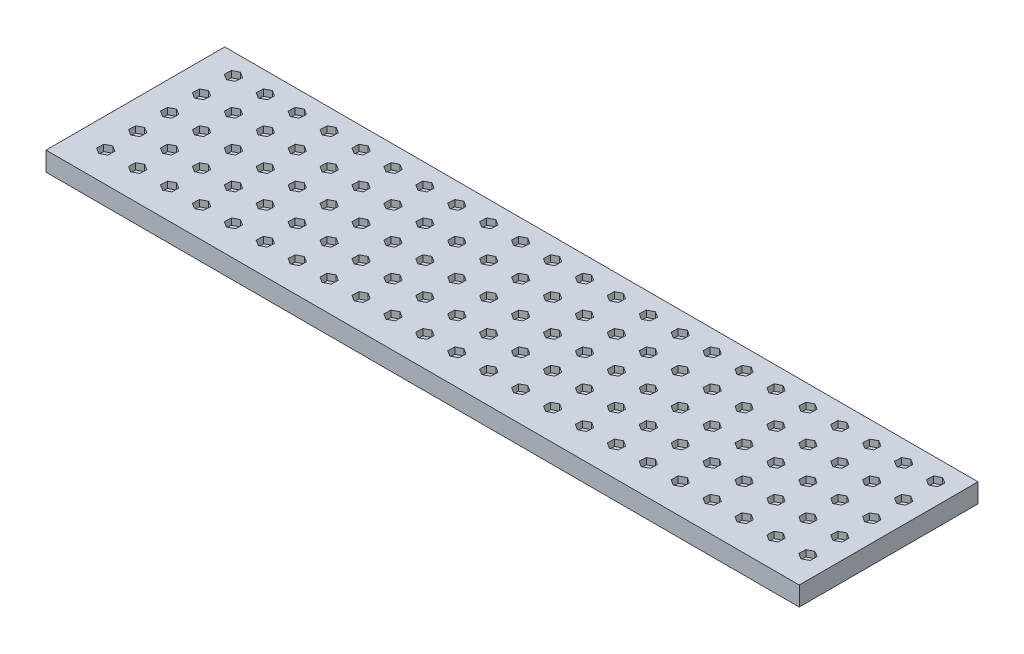
from build123d import *

# Parameters (mm, degrees)
SKETCH1_W           = 236
SKETCH1_H           = 56
BOSS_EXTRUDE1_DEPTH = 6
CUT_EXTRUDE1_DEPTH  = 2
CUT_EXTRUDE2_DEPTH  = 2


with BuildPart() as part:
    # Sketch1 → Boss-Extrude1 (new body)
    with BuildSketch(Plane(origin=(0, 0, 0), x_dir=(1, 0, 0), z_dir=(0, 1, 0))):
        Rectangle(SKETCH1_W, SKETCH1_H)
    extrude(amount=BOSS_EXTRUDE1_DEPTH)

    # Sketch2 → Cut-Extrude1 (cut)
    with BuildSketch(Plane(origin=(0, 6, 0), x_dir=(1, 0, 0), z_dir=(0, 1, 0))):
        Polygon((-96.969664565, 20.342464515), (-96.878055923, 22.465137638), (-98.670540451, 23.605809611), (-100.554633621, 22.62380846), (-100.646242263, 20.501135336), (-98.853757734, 19.360463364), align=None)
        Polygon((-106.969664565, 20.342464515), (-106.878055923, 22.465137638), (-108.670540451, 23.605809611), (-110.554633621, 22.62380846), (-110.646242263, 20.501135336), (-108.853757734, 19.360463364), align=None)
        Polygon((-86.969664565, 20.342464515), (-86.878055923, 22.465137638), (-88.670540451, 23.605809611), (-90.554633621, 22.62380846), (-90.646242263, 20.501135336), (-88.853757734, 19.360463364), align=None)
        Polygon((-76.969664565, 20.342464515), (-76.878055923, 22.465137638), (-78.670540451, 23.605809611), (-80.554633621, 22.62380846), (-80.646242263, 20.501135336), (-78.853757734, 19.360463364), align=None)
        Polygon((-66.969664565, 20.342464515), (-66.878055923, 22.465137638), (-68.670540451, 23.605809611), (-70.554633621, 22.62380846), (-70.646242263, 20.501135336), (-68.853757734, 19.360463364), align=None)
        Polygon((-56.969664565, 20.342464515), (-56.878055923, 22.465137638), (-58.670540451, 23.605809611), (-60.554633621, 22.62380846), (-60.646242263, 20.501135336), (-58.853757734, 19.360463364), align=None)
        Polygon((-46.969664565, 20.342464515), (-46.878055923, 22.465137638), (-48.670540451, 23.605809611), (-50.554633621, 22.62380846), (-50.646242263, 20.501135336), (-48.853757734, 19.360463364), align=None)
        Polygon((-36.969664565, 20.342464515), (-36.878055923, 22.465137638), (-38.670540451, 23.605809611), (-40.554633621, 22.62380846), (-40.646242263, 20.501135336), (-38.853757734, 19.360463364), align=None)
        Polygon((-26.969664565, 20.342464515), (-26.878055923, 22.465137638), (-28.670540451, 23.605809611), (-30.554633621, 22.62380846), (-30.646242263, 20.501135336), (-28.853757734, 19.360463364), align=None)
        Polygon((-16.969664565, 20.342464515), (-16.878055923, 22.465137638), (-18.670540451, 23.605809611), (-20.554633621, 22.62380846), (-20.646242263, 20.501135336), (-18.853757734, 19.360463364), align=None)
        Polygon((-6.969664565, 20.342464515), (-6.878055923, 22.465137638), (-8.670540451, 23.605809611), (-10.554633621, 22.62380846), (-10.646242263, 20.501135336), (-8.853757734, 19.360463364), align=None)
        Polygon((3.030335435, 20.342464515), (3.121944077, 22.465137638), (1.329459549, 23.605809611), (-0.554633621, 22.62380846), (-0.646242263, 20.501135336), (1.146242266, 19.360463364), align=None)
        Polygon((13.030335435, 20.342464515), (13.121944077, 22.465137638), (11.329459549, 23.605809611), (9.445366379, 22.62380846), (9.353757737, 20.501135336), (11.146242266, 19.360463364), align=None)
        Polygon((23.030335435, 20.342464515), (23.121944077, 22.465137638), (21.329459549, 23.605809611), (19.445366379, 22.62380846), (19.353757737, 20.501135336), (21.146242266, 19.360463364), align=None)
        Polygon((33.030335435, 20.342464515), (33.121944077, 22.465137638), (31.329459549, 23.605809611), (29.445366379, 22.62380846), (29.353757737, 20.501135336), (31.146242266, 19.360463364), align=None)
        Polygon((43.030335435, 20.342464515), (43.121944077, 22.465137638), (41.329459549, 23.605809611), (39.445366379, 22.62380846), (39.353757737, 20.501135336), (41.146242266, 19.360463364), align=None)
        Polygon((53.030335435, 20.342464515), (53.121944077, 22.465137638), (51.329459549, 23.605809611), (49.445366379, 22.62380846), (49.353757737, 20.501135336), (51.146242266, 19.360463364), align=None)
        Polygon((63.030335435, 20.342464515), (63.121944077, 22.465137638), (61.329459549, 23.605809611), (59.445366379, 22.62380846), (59.353757737, 20.501135336), (61.146242266, 19.360463364), align=None)
        Polygon((73.030335435, 20.342464515), (73.121944077, 22.465137638), (71.329459549, 23.605809611), (69.445366379, 22.62380846), (69.353757737, 20.501135336), (71.146242266, 19.360463364), align=None)
        Polygon((83.030335435, 20.342464515), (83.121944077, 22.465137638), (81.329459549, 23.605809611), (79.445366379, 22.62380846), (79.353757737, 20.501135336), (81.146242266, 19.360463364), align=None)
        Polygon((93.030335435, 20.342464515), (93.121944077, 22.465137638), (91.329459549, 23.605809611), (89.445366379, 22.62380846), (89.353757737, 20.501135336), (91.146242266, 19.360463364), align=None)
        Polygon((103.030335435, 20.342464515), (103.121944077, 22.465137638), (101.329459549, 23.605809611), (99.445366379, 22.62380846), (99.353757737, 20.501135336), (101.146242266, 19.360463364), align=None)
        Polygon((113.030335435, 20.342464515), (113.121944077, 22.465137638), (111.329459549, 23.605809611), (109.445366379, 22.62380846), (109.353757737, 20.501135336), (111.146242266, 19.360463364), align=None)
        Polygon((-96.969664565, 10.342464515), (-96.878055923, 12.465137638), (-98.670540451, 13.605809611), (-100.554633621, 12.62380846), (-100.646242263, 10.501135336), (-98.853757734, 9.360463364), align=None)
        Polygon((-86.969664565, 10.342464515), (-86.878055923, 12.465137638), (-88.670540451, 13.605809611), (-90.554633621, 12.62380846), (-90.646242263, 10.501135336), (-88.853757734, 9.360463364), align=None)
        Polygon((-76.969664565, 10.342464515), (-76.878055923, 12.465137638), (-78.670540451, 13.605809611), (-80.554633621, 12.62380846), (-80.646242263, 10.501135336), (-78.853757734, 9.360463364), align=None)
        Polygon((-66.969664565, 10.342464515), (-66.878055923, 12.465137638), (-68.670540451, 13.605809611), (-70.554633621, 12.62380846), (-70.646242263, 10.501135336), (-68.853757734, 9.360463364), align=None)
        Polygon((-56.969664565, 10.342464515), (-56.878055923, 12.465137638), (-58.670540451, 13.605809611), (-60.554633621, 12.62380846), (-60.646242263, 10.501135336), (-58.853757734, 9.360463364), align=None)
        Polygon((-46.969664565, 10.342464515), (-46.878055923, 12.465137638), (-48.670540451, 13.605809611), (-50.554633621, 12.62380846), (-50.646242263, 10.501135336), (-48.853757734, 9.360463364), align=None)
        Polygon((-36.969664565, 10.342464515), (-36.878055923, 12.465137638), (-38.670540451, 13.605809611), (-40.554633621, 12.62380846), (-40.646242263, 10.501135336), (-38.853757734, 9.360463364), align=None)
        Polygon((-26.969664565, 10.342464515), (-26.878055923, 12.465137638), (-28.670540451, 13.605809611), (-30.554633621, 12.62380846), (-30.646242263, 10.501135336), (-28.853757734, 9.360463364), align=None)
        Polygon((-16.969664565, 10.342464515), (-16.878055923, 12.465137638), (-18.670540451, 13.605809611), (-20.554633621, 12.62380846), (-20.646242263, 10.501135336), (-18.853757734, 9.360463364), align=None)
        Polygon((-6.969664565, 10.342464515), (-6.878055923, 12.465137638), (-8.670540451, 13.605809611), (-10.554633621, 12.62380846), (-10.646242263, 10.501135336), (-8.853757734, 9.360463364), align=None)
        Polygon((3.030335435, 10.342464515), (3.121944077, 12.465137638), (1.329459549, 13.605809611), (-0.554633621, 12.62380846), (-0.646242263, 10.501135336), (1.146242266, 9.360463364), align=None)
        Polygon((13.030335435, 10.342464515), (13.121944077, 12.465137638), (11.329459549, 13.605809611), (9.445366379, 12.62380846), (9.353757737, 10.501135336), (11.146242266, 9.360463364), align=None)
        Polygon((23.030335435, 10.342464515), (23.121944077, 12.465137638), (21.329459549, 13.605809611), (19.445366379, 12.62380846), (19.353757737, 10.501135336), (21.146242266, 9.360463364), align=None)
        Polygon((33.030335435, 10.342464515), (33.121944077, 12.465137638), (31.329459549, 13.605809611), (29.445366379, 12.62380846), (29.353757737, 10.501135336), (31.146242266, 9.360463364), align=None)
        Polygon((43.030335435, 10.342464515), (43.121944077, 12.465137638), (41.329459549, 13.605809611), (39.445366379, 12.62380846), (39.353757737, 10.501135336), (41.146242266, 9.360463364), align=None)
        Polygon((53.030335435, 10.342464515), (53.121944077, 12.465137638), (51.329459549, 13.605809611), (49.445366379, 12.62380846), (49.353757737, 10.501135336), (51.146242266, 9.360463364), align=None)
        Polygon((63.030335435, 10.342464515), (63.121944077, 12.465137638), (61.329459549, 13.605809611), (59.445366379, 12.62380846), (59.353757737, 10.501135336), (61.146242266, 9.360463364), align=None)
        Polygon((73.030335435, 10.342464515), (73.121944077, 12.465137638), (71.329459549, 13.605809611), (69.445366379, 12.62380846), (69.353757737, 10.501135336), (71.146242266, 9.360463364), align=None)
        Polygon((83.030335435, 10.342464515), (83.121944077, 12.465137638), (81.329459549, 13.605809611), (79.445366379, 12.62380846), (79.353757737, 10.501135336), (81.146242266, 9.360463364), align=None)
        Polygon((93.030335435, 10.342464515), (93.121944077, 12.465137638), (91.329459549, 13.605809611), (89.445366379, 12.62380846), (89.353757737, 10.501135336), (91.146242266, 9.360463364), align=None)
        Polygon((103.030335435, 10.342464515), (103.121944077, 12.465137638), (101.329459549, 13.605809611), (99.445366379, 12.62380846), (99.353757737, 10.501135336), (101.146242266, 9.360463364), align=None)
        Polygon((113.030335435, 10.342464515), (113.121944077, 12.465137638), (111.329459549, 13.605809611), (109.445366379, 12.62380846), (109.353757737, 10.501135336), (111.146242266, 9.360463364), align=None)
        Polygon((-96.969664565, 0.342464515), (-96.878055923, 2.465137638), (-98.670540451, 3.605809611), (-100.554633621, 2.62380846), (-100.646242263, 0.501135336), (-98.853757734, -0.639536636), align=None)
        Polygon((-86.969664565, 0.342464515), (-86.878055923, 2.465137638), (-88.670540451, 3.605809611), (-90.554633621, 2.62380846), (-90.646242263, 0.501135336), (-88.853757734, -0.639536636), align=None)
        Polygon((-76.969664565, 0.342464515), (-76.878055923, 2.465137638), (-78.670540451, 3.605809611), (-80.554633621, 2.62380846), (-80.646242263, 0.501135336), (-78.853757734, -0.639536636), align=None)
        Polygon((-66.969664565, 0.342464515), (-66.878055923, 2.465137638), (-68.670540451, 3.605809611), (-70.554633621, 2.62380846), (-70.646242263, 0.501135336), (-68.853757734, -0.639536636), align=None)
        Polygon((-56.969664565, 0.342464515), (-56.878055923, 2.465137638), (-58.670540451, 3.605809611), (-60.554633621, 2.62380846), (-60.646242263, 0.501135336), (-58.853757734, -0.639536636), align=None)
        Polygon((-46.969664565, 0.342464515), (-46.878055923, 2.465137638), (-48.670540451, 3.605809611), (-50.554633621, 2.62380846), (-50.646242263, 0.501135336), (-48.853757734, -0.639536636), align=None)
        Polygon((-36.969664565, 0.342464515), (-36.878055923, 2.465137638), (-38.670540451, 3.605809611), (-40.554633621, 2.62380846), (-40.646242263, 0.501135336), (-38.853757734, -0.639536636), align=None)
        Polygon((-26.969664565, 0.342464515), (-26.878055923, 2.465137638), (-28.670540451, 3.605809611), (-30.554633621, 2.62380846), (-30.646242263, 0.501135336), (-28.853757734, -0.639536636), align=None)
        Polygon((-16.969664565, 0.342464515), (-16.878055923, 2.465137638), (-18.670540451, 3.605809611), (-20.554633621, 2.62380846), (-20.646242263, 0.501135336), (-18.853757734, -0.639536636), align=None)
        Polygon((-6.969664565, 0.342464515), (-6.878055923, 2.465137638), (-8.670540451, 3.605809611), (-10.554633621, 2.62380846), (-10.646242263, 0.501135336), (-8.853757734, -0.639536636), align=None)
        Polygon((3.030335435, 0.342464515), (3.121944077, 2.465137638), (1.329459549, 3.605809611), (-0.554633621, 2.62380846), (-0.646242263, 0.501135336), (1.146242266, -0.639536636), align=None)
        Polygon((13.030335435, 0.342464515), (13.121944077, 2.465137638), (11.329459549, 3.605809611), (9.445366379, 2.62380846), (9.353757737, 0.501135336), (11.146242266, -0.639536636), align=None)
        Polygon((23.030335435, 0.342464515), (23.121944077, 2.465137638), (21.329459549, 3.605809611), (19.445366379, 2.62380846), (19.353757737, 0.501135336), (21.146242266, -0.639536636), align=None)
        Polygon((33.030335435, 0.342464515), (33.121944077, 2.465137638), (31.329459549, 3.605809611), (29.445366379, 2.62380846), (29.353757737, 0.501135336), (31.146242266, -0.639536636), align=None)
        Polygon((43.030335435, 0.342464515), (43.121944077, 2.465137638), (41.329459549, 3.605809611), (39.445366379, 2.62380846), (39.353757737, 0.501135336), (41.146242266, -0.639536636), align=None)
        Polygon((53.030335435, 0.342464515), (53.121944077, 2.465137638), (51.329459549, 3.605809611), (49.445366379, 2.62380846), (49.353757737, 0.501135336), (51.146242266, -0.639536636), align=None)
        Polygon((63.030335435, 0.342464515), (63.121944077, 2.465137638), (61.329459549, 3.605809611), (59.445366379, 2.62380846), (59.353757737, 0.501135336), (61.146242266, -0.639536636), align=None)
        Polygon((73.030335435, 0.342464515), (73.121944077, 2.465137638), (71.329459549, 3.605809611), (69.445366379, 2.62380846), (69.353757737, 0.501135336), (71.146242266, -0.639536636), align=None)
        Polygon((83.030335435, 0.342464515), (83.121944077, 2.465137638), (81.329459549, 3.605809611), (79.445366379, 2.62380846), (79.353757737, 0.501135336), (81.146242266, -0.639536636), align=None)
        Polygon((93.030335435, 0.342464515), (93.121944077, 2.465137638), (91.329459549, 3.605809611), (89.445366379, 2.62380846), (89.353757737, 0.501135336), (91.146242266, -0.639536636), align=None)
        Polygon((103.030335435, 0.342464515), (103.121944077, 2.465137638), (101.329459549, 3.605809611), (99.445366379, 2.62380846), (99.353757737, 0.501135336), (101.146242266, -0.639536636), align=None)
        Polygon((113.030335435, 0.342464515), (113.121944077, 2.465137638), (111.329459549, 3.605809611), (109.445366379, 2.62380846), (109.353757737, 0.501135336), (111.146242266, -0.639536636), align=None)
        Polygon((-96.969664565, -9.657535485), (-96.878055923, -7.534862362), (-98.670540451, -6.394190389), (-100.554633621, -7.37619154), (-100.646242263, -9.498864664), (-98.853757734, -10.639536636), align=None)
        Polygon((-86.969664565, -9.657535485), (-86.878055923, -7.534862362), (-88.670540451, -6.394190389), (-90.554633621, -7.37619154), (-90.646242263, -9.498864664), (-88.853757734, -10.639536636), align=None)
        Polygon((-76.969664565, -9.657535485), (-76.878055923, -7.534862362), (-78.670540451, -6.394190389), (-80.554633621, -7.37619154), (-80.646242263, -9.498864664), (-78.853757734, -10.639536636), align=None)
        Polygon((-66.969664565, -9.657535485), (-66.878055923, -7.534862362), (-68.670540451, -6.394190389), (-70.554633621, -7.37619154), (-70.646242263, -9.498864664), (-68.853757734, -10.639536636), align=None)
        Polygon((-56.969664565, -9.657535485), (-56.878055923, -7.534862362), (-58.670540451, -6.394190389), (-60.554633621, -7.37619154), (-60.646242263, -9.498864664), (-58.853757734, -10.639536636), align=None)
        Polygon((-46.969664565, -9.657535485), (-46.878055923, -7.534862362), (-48.670540451, -6.394190389), (-50.554633621, -7.37619154), (-50.646242263, -9.498864664), (-48.853757734, -10.639536636), align=None)
        Polygon((-36.969664565, -9.657535485), (-36.878055923, -7.534862362), (-38.670540451, -6.394190389), (-40.554633621, -7.37619154), (-40.646242263, -9.498864664), (-38.853757734, -10.639536636), align=None)
        Polygon((-26.969664565, -9.657535485), (-26.878055923, -7.534862362), (-28.670540451, -6.394190389), (-30.554633621, -7.37619154), (-30.646242263, -9.498864664), (-28.853757734, -10.639536636), align=None)
        Polygon((-16.969664565, -9.657535485), (-16.878055923, -7.534862362), (-18.670540451, -6.394190389), (-20.554633621, -7.37619154), (-20.646242263, -9.498864664), (-18.853757734, -10.639536636), align=None)
        Polygon((-6.969664565, -9.657535485), (-6.878055923, -7.534862362), (-8.670540451, -6.394190389), (-10.554633621, -7.37619154), (-10.646242263, -9.498864664), (-8.853757734, -10.639536636), align=None)
        Polygon((3.030335435, -9.657535485), (3.121944077, -7.534862362), (1.329459549, -6.394190389), (-0.554633621, -7.37619154), (-0.646242263, -9.498864664), (1.146242266, -10.639536636), align=None)
        Polygon((13.030335435, -9.657535485), (13.121944077, -7.534862362), (11.329459549, -6.394190389), (9.445366379, -7.37619154), (9.353757737, -9.498864664), (11.146242266, -10.639536636), align=None)
        Polygon((23.030335435, -9.657535485), (23.121944077, -7.534862362), (21.329459549, -6.394190389), (19.445366379, -7.37619154), (19.353757737, -9.498864664), (21.146242266, -10.639536636), align=None)
        Polygon((33.030335435, -9.657535485), (33.121944077, -7.534862362), (31.329459549, -6.394190389), (29.445366379, -7.37619154), (29.353757737, -9.498864664), (31.146242266, -10.639536636), align=None)
        Polygon((43.030335435, -9.657535485), (43.121944077, -7.534862362), (41.329459549, -6.394190389), (39.445366379, -7.37619154), (39.353757737, -9.498864664), (41.146242266, -10.639536636), align=None)
        Polygon((53.030335435, -9.657535485), (53.121944077, -7.534862362), (51.329459549, -6.394190389), (49.445366379, -7.37619154), (49.353757737, -9.498864664), (51.146242266, -10.639536636), align=None)
        Polygon((63.030335435, -9.657535485), (63.121944077, -7.534862362), (61.329459549, -6.394190389), (59.445366379, -7.37619154), (59.353757737, -9.498864664), (61.146242266, -10.639536636), align=None)
        Polygon((73.030335435, -9.657535485), (73.121944077, -7.534862362), (71.329459549, -6.394190389), (69.445366379, -7.37619154), (69.353757737, -9.498864664), (71.146242266, -10.639536636), align=None)
        Polygon((83.030335435, -9.657535485), (83.121944077, -7.534862362), (81.329459549, -6.394190389), (79.445366379, -7.37619154), (79.353757737, -9.498864664), (81.146242266, -10.639536636), align=None)
        Polygon((93.030335435, -9.657535485), (93.121944077, -7.534862362), (91.329459549, -6.394190389), (89.445366379, -7.37619154), (89.353757737, -9.498864664), (91.146242266, -10.639536636), align=None)
        Polygon((103.030335435, -9.657535485), (103.121944077, -7.534862362), (101.329459549, -6.394190389), (99.445366379, -7.37619154), (99.353757737, -9.498864664), (101.146242266, -10.639536636), align=None)
        Polygon((113.030335435, -9.657535485), (113.121944077, -7.534862362), (111.329459549, -6.394190389), (109.445366379, -7.37619154), (109.353757737, -9.498864664), (111.146242266, -10.639536636), align=None)
        Polygon((-96.969664565, -19.657535485), (-96.878055923, -17.534862362), (-98.670540451, -16.394190389), (-100.554633621, -17.37619154), (-100.646242263, -19.498864664), (-98.853757734, -20.639536636), align=None)
        Polygon((-86.969664565, -19.657535485), (-86.878055923, -17.534862362), (-88.670540451, -16.394190389), (-90.554633621, -17.37619154), (-90.646242263, -19.498864664), (-88.853757734, -20.639536636), align=None)
        Polygon((-76.969664565, -19.657535485), (-76.878055923, -17.534862362), (-78.670540451, -16.394190389), (-80.554633621, -17.37619154), (-80.646242263, -19.498864664), (-78.853757734, -20.639536636), align=None)
        Polygon((-66.969664565, -19.657535485), (-66.878055923, -17.534862362), (-68.670540451, -16.394190389), (-70.554633621, -17.37619154), (-70.646242263, -19.498864664), (-68.853757734, -20.639536636), align=None)
        Polygon((-56.969664565, -19.657535485), (-56.878055923, -17.534862362), (-58.670540451, -16.394190389), (-60.554633621, -17.37619154), (-60.646242263, -19.498864664), (-58.853757734, -20.639536636), align=None)
        Polygon((-46.969664565, -19.657535485), (-46.878055923, -17.534862362), (-48.670540451, -16.394190389), (-50.554633621, -17.37619154), (-50.646242263, -19.498864664), (-48.853757734, -20.639536636), align=None)
        Polygon((-36.969664565, -19.657535485), (-36.878055923, -17.534862362), (-38.670540451, -16.394190389), (-40.554633621, -17.37619154), (-40.646242263, -19.498864664), (-38.853757734, -20.639536636), align=None)
        Polygon((-26.969664565, -19.657535485), (-26.878055923, -17.534862362), (-28.670540451, -16.394190389), (-30.554633621, -17.37619154), (-30.646242263, -19.498864664), (-28.853757734, -20.639536636), align=None)
        Polygon((-16.969664565, -19.657535485), (-16.878055923, -17.534862362), (-18.670540451, -16.394190389), (-20.554633621, -17.37619154), (-20.646242263, -19.498864664), (-18.853757734, -20.639536636), align=None)
        Polygon((-6.969664565, -19.657535485), (-6.878055923, -17.534862362), (-8.670540451, -16.394190389), (-10.554633621, -17.37619154), (-10.646242263, -19.498864664), (-8.853757734, -20.639536636), align=None)
        Polygon((3.030335435, -19.657535485), (3.121944077, -17.534862362), (1.329459549, -16.394190389), (-0.554633621, -17.37619154), (-0.646242263, -19.498864664), (1.146242266, -20.639536636), align=None)
        Polygon((13.030335435, -19.657535485), (13.121944077, -17.534862362), (11.329459549, -16.394190389), (9.445366379, -17.37619154), (9.353757737, -19.498864664), (11.146242266, -20.639536636), align=None)
        Polygon((23.030335435, -19.657535485), (23.121944077, -17.534862362), (21.329459549, -16.394190389), (19.445366379, -17.37619154), (19.353757737, -19.498864664), (21.146242266, -20.639536636), align=None)
        Polygon((33.030335435, -19.657535485), (33.121944077, -17.534862362), (31.329459549, -16.394190389), (29.445366379, -17.37619154), (29.353757737, -19.498864664), (31.146242266, -20.639536636), align=None)
        Polygon((43.030335435, -19.657535485), (43.121944077, -17.534862362), (41.329459549, -16.394190389), (39.445366379, -17.37619154), (39.353757737, -19.498864664), (41.146242266, -20.639536636), align=None)
        Polygon((53.030335435, -19.657535485), (53.121944077, -17.534862362), (51.329459549, -16.394190389), (49.445366379, -17.37619154), (49.353757737, -19.498864664), (51.146242266, -20.639536636), align=None)
        Polygon((63.030335435, -19.657535485), (63.121944077, -17.534862362), (61.329459549, -16.394190389), (59.445366379, -17.37619154), (59.353757737, -19.498864664), (61.146242266, -20.639536636), align=None)
        Polygon((73.030335435, -19.657535485), (73.121944077, -17.534862362), (71.329459549, -16.394190389), (69.445366379, -17.37619154), (69.353757737, -19.498864664), (71.146242266, -20.639536636), align=None)
        Polygon((83.030335435, -19.657535485), (83.121944077, -17.534862362), (81.329459549, -16.394190389), (79.445366379, -17.37619154), (79.353757737, -19.498864664), (81.146242266, -20.639536636), align=None)
        Polygon((93.030335435, -19.657535485), (93.121944077, -17.534862362), (91.329459549, -16.394190389), (89.445366379, -17.37619154), (89.353757737, -19.498864664), (91.146242266, -20.639536636), align=None)
        Polygon((103.030335435, -19.657535485), (103.121944077, -17.534862362), (101.329459549, -16.394190389), (99.445366379, -17.37619154), (99.353757737, -19.498864664), (101.146242266, -20.639536636), align=None)
        Polygon((113.030335435, -19.657535485), (113.121944077, -17.534862362), (111.329459549, -16.394190389), (109.445366379, -17.37619154), (109.353757737, -19.498864664), (111.146242266, -20.639536636), align=None)
        Polygon((-106.969664565, 10.342464515), (-106.878055923, 12.465137638), (-108.670540451, 13.605809611), (-110.554633621, 12.62380846), (-110.646242263, 10.501135336), (-108.853757734, 9.360463364), align=None)
        Polygon((-106.969664565, 0.342464515), (-106.878055923, 2.465137638), (-108.670540451, 3.605809611), (-110.554633621, 2.62380846), (-110.646242263, 0.501135336), (-108.853757734, -0.639536636), align=None)
        Polygon((-106.969664565, -9.657535485), (-106.878055923, -7.534862362), (-108.670540451, -6.394190389), (-110.554633621, -7.37619154), (-110.646242263, -9.498864664), (-108.853757734, -10.639536636), align=None)
        Polygon((-106.969664565, -19.657535485), (-106.878055923, -17.534862362), (-108.670540451, -16.394190389), (-110.554633621, -17.37619154), (-110.646242263, -19.498864664), (-108.853757734, -20.639536636), align=None)
    extrude(amount=-CUT_EXTRUDE1_DEPTH, mode=Mode.SUBTRACT)

    # Sketch3 → Cut-Extrude2 (cut)
    with BuildSketch(Plane.XZ):
        Polygon((-97.156278287, 20.056363505), (-96.902137883, 22.165758203), (-98.601857076, 23.440547597), (-100.555716672, 22.605942294), (-100.809857076, 20.496547597), (-99.110137883, 19.221758203), align=None)
        Polygon((-107.156278287, 20.056363505), (-106.902137883, 22.165758203), (-108.601857076, 23.440547597), (-110.555716672, 22.605942294), (-110.809857076, 20.496547597), (-109.110137883, 19.221758203), align=None)
        Polygon((-87.156278287, 20.056363505), (-86.902137883, 22.165758203), (-88.601857076, 23.440547597), (-90.555716672, 22.605942294), (-90.809857076, 20.496547597), (-89.110137883, 19.221758203), align=None)
        Polygon((-77.156278287, 20.056363505), (-76.902137883, 22.165758203), (-78.601857076, 23.440547597), (-80.555716672, 22.605942294), (-80.809857076, 20.496547597), (-79.110137883, 19.221758203), align=None)
        Polygon((-67.156278287, 20.056363505), (-66.902137883, 22.165758203), (-68.601857076, 23.440547597), (-70.555716672, 22.605942294), (-70.809857076, 20.496547597), (-69.110137883, 19.221758203), align=None)
        Polygon((-57.156278287, 20.056363505), (-56.902137883, 22.165758203), (-58.601857076, 23.440547597), (-60.555716672, 22.605942294), (-60.809857076, 20.496547597), (-59.110137883, 19.221758203), align=None)
        Polygon((-47.156278287, 20.056363505), (-46.902137883, 22.165758203), (-48.601857076, 23.440547597), (-50.555716672, 22.605942294), (-50.809857076, 20.496547597), (-49.110137883, 19.221758203), align=None)
        Polygon((-37.156278287, 20.056363505), (-36.902137883, 22.165758203), (-38.601857076, 23.440547597), (-40.555716672, 22.605942294), (-40.809857076, 20.496547597), (-39.110137883, 19.221758203), align=None)
        Polygon((-27.156278287, 20.056363505), (-26.902137883, 22.165758203), (-28.601857076, 23.440547597), (-30.555716672, 22.605942294), (-30.809857076, 20.496547597), (-29.110137883, 19.221758203), align=None)
        Polygon((-17.156278287, 20.056363505), (-16.902137883, 22.165758203), (-18.601857076, 23.440547597), (-20.555716672, 22.605942294), (-20.809857076, 20.496547597), (-19.110137883, 19.221758203), align=None)
        Polygon((-7.156278287, 20.056363505), (-6.902137883, 22.165758203), (-8.601857076, 23.440547597), (-10.555716672, 22.605942294), (-10.809857076, 20.496547597), (-9.110137883, 19.221758203), align=None)
        Polygon((2.843721713, 20.056363505), (3.097862117, 22.165758203), (1.398142924, 23.440547597), (-0.555716672, 22.605942294), (-0.809857076, 20.496547597), (0.889862117, 19.221758203), align=None)
        Polygon((12.843721713, 20.056363505), (13.097862117, 22.165758203), (11.398142924, 23.440547597), (9.444283328, 22.605942294), (9.190142924, 20.496547597), (10.889862117, 19.221758203), align=None)
        Polygon((22.843721713, 20.056363505), (23.097862117, 22.165758203), (21.398142924, 23.440547597), (19.444283328, 22.605942294), (19.190142924, 20.496547597), (20.889862117, 19.221758203), align=None)
        Polygon((32.843721713, 20.056363505), (33.097862117, 22.165758203), (31.398142924, 23.440547597), (29.444283328, 22.605942294), (29.190142924, 20.496547597), (30.889862117, 19.221758203), align=None)
        Polygon((42.843721713, 20.056363505), (43.097862117, 22.165758203), (41.398142924, 23.440547597), (39.444283328, 22.605942294), (39.190142924, 20.496547597), (40.889862117, 19.221758203), align=None)
        Polygon((52.843721713, 20.056363505), (53.097862117, 22.165758203), (51.398142924, 23.440547597), (49.444283328, 22.605942294), (49.190142924, 20.496547597), (50.889862117, 19.221758203), align=None)
        Polygon((62.843721713, 20.056363505), (63.097862117, 22.165758203), (61.398142924, 23.440547597), (59.444283328, 22.605942294), (59.190142924, 20.496547597), (60.889862117, 19.221758203), align=None)
        Polygon((72.843721713, 20.056363505), (73.097862117, 22.165758203), (71.398142924, 23.440547597), (69.444283328, 22.605942294), (69.190142924, 20.496547597), (70.889862117, 19.221758203), align=None)
        Polygon((82.843721713, 20.056363505), (83.097862117, 22.165758203), (81.398142924, 23.440547597), (79.444283328, 22.605942294), (79.190142924, 20.496547597), (80.889862117, 19.221758203), align=None)
        Polygon((92.843721713, 20.056363505), (93.097862117, 22.165758203), (91.398142924, 23.440547597), (89.444283328, 22.605942294), (89.190142924, 20.496547597), (90.889862117, 19.221758203), align=None)
        Polygon((102.843721713, 20.056363505), (103.097862117, 22.165758203), (101.398142924, 23.440547597), (99.444283328, 22.605942294), (99.190142924, 20.496547597), (100.889862117, 19.221758203), align=None)
        Polygon((112.843721713, 20.056363505), (113.097862117, 22.165758203), (111.398142924, 23.440547597), (109.444283328, 22.605942294), (109.190142924, 20.496547597), (110.889862117, 19.221758203), align=None)
        Polygon((-97.156278287, 10.056363505), (-96.902137883, 12.165758203), (-98.601857076, 13.440547597), (-100.555716672, 12.605942294), (-100.809857076, 10.496547597), (-99.110137883, 9.221758203), align=None)
        Polygon((-87.156278287, 10.056363505), (-86.902137883, 12.165758203), (-88.601857076, 13.440547597), (-90.555716672, 12.605942294), (-90.809857076, 10.496547597), (-89.110137883, 9.221758203), align=None)
        Polygon((-77.156278287, 10.056363505), (-76.902137883, 12.165758203), (-78.601857076, 13.440547597), (-80.555716672, 12.605942294), (-80.809857076, 10.496547597), (-79.110137883, 9.221758203), align=None)
        Polygon((-67.156278287, 10.056363505), (-66.902137883, 12.165758203), (-68.601857076, 13.440547597), (-70.555716672, 12.605942294), (-70.809857076, 10.496547597), (-69.110137883, 9.221758203), align=None)
        Polygon((-57.156278287, 10.056363505), (-56.902137883, 12.165758203), (-58.601857076, 13.440547597), (-60.555716672, 12.605942294), (-60.809857076, 10.496547597), (-59.110137883, 9.221758203), align=None)
        Polygon((-47.156278287, 10.056363505), (-46.902137883, 12.165758203), (-48.601857076, 13.440547597), (-50.555716672, 12.605942294), (-50.809857076, 10.496547597), (-49.110137883, 9.221758203), align=None)
        Polygon((-37.156278287, 10.056363505), (-36.902137883, 12.165758203), (-38.601857076, 13.440547597), (-40.555716672, 12.605942294), (-40.809857076, 10.496547597), (-39.110137883, 9.221758203), align=None)
        Polygon((-27.156278287, 10.056363505), (-26.902137883, 12.165758203), (-28.601857076, 13.440547597), (-30.555716672, 12.605942294), (-30.809857076, 10.496547597), (-29.110137883, 9.221758203), align=None)
        Polygon((-17.156278287, 10.056363505), (-16.902137883, 12.165758203), (-18.601857076, 13.440547597), (-20.555716672, 12.605942294), (-20.809857076, 10.496547597), (-19.110137883, 9.221758203), align=None)
        Polygon((-7.156278287, 10.056363505), (-6.902137883, 12.165758203), (-8.601857076, 13.440547597), (-10.555716672, 12.605942294), (-10.809857076, 10.496547597), (-9.110137883, 9.221758203), align=None)
        Polygon((2.843721713, 10.056363505), (3.097862117, 12.165758203), (1.398142924, 13.440547597), (-0.555716672, 12.605942294), (-0.809857076, 10.496547597), (0.889862117, 9.221758203), align=None)
        Polygon((12.843721713, 10.056363505), (13.097862117, 12.165758203), (11.398142924, 13.440547597), (9.444283328, 12.605942294), (9.190142924, 10.496547597), (10.889862117, 9.221758203), align=None)
        Polygon((22.843721713, 10.056363505), (23.097862117, 12.165758203), (21.398142924, 13.440547597), (19.444283328, 12.605942294), (19.190142924, 10.496547597), (20.889862117, 9.221758203), align=None)
        Polygon((32.843721713, 10.056363505), (33.097862117, 12.165758203), (31.398142924, 13.440547597), (29.444283328, 12.605942294), (29.190142924, 10.496547597), (30.889862117, 9.221758203), align=None)
        Polygon((42.843721713, 10.056363505), (43.097862117, 12.165758203), (41.398142924, 13.440547597), (39.444283328, 12.605942294), (39.190142924, 10.496547597), (40.889862117, 9.221758203), align=None)
        Polygon((52.843721713, 10.056363505), (53.097862117, 12.165758203), (51.398142924, 13.440547597), (49.444283328, 12.605942294), (49.190142924, 10.496547597), (50.889862117, 9.221758203), align=None)
        Polygon((62.843721713, 10.056363505), (63.097862117, 12.165758203), (61.398142924, 13.440547597), (59.444283328, 12.605942294), (59.190142924, 10.496547597), (60.889862117, 9.221758203), align=None)
        Polygon((72.843721713, 10.056363505), (73.097862117, 12.165758203), (71.398142924, 13.440547597), (69.444283328, 12.605942294), (69.190142924, 10.496547597), (70.889862117, 9.221758203), align=None)
        Polygon((82.843721713, 10.056363505), (83.097862117, 12.165758203), (81.398142924, 13.440547597), (79.444283328, 12.605942294), (79.190142924, 10.496547597), (80.889862117, 9.221758203), align=None)
        Polygon((92.843721713, 10.056363505), (93.097862117, 12.165758203), (91.398142924, 13.440547597), (89.444283328, 12.605942294), (89.190142924, 10.496547597), (90.889862117, 9.221758203), align=None)
        Polygon((102.843721713, 10.056363505), (103.097862117, 12.165758203), (101.398142924, 13.440547597), (99.444283328, 12.605942294), (99.190142924, 10.496547597), (100.889862117, 9.221758203), align=None)
        Polygon((112.843721713, 10.056363505), (113.097862117, 12.165758203), (111.398142924, 13.440547597), (109.444283328, 12.605942294), (109.190142924, 10.496547597), (110.889862117, 9.221758203), align=None)
        Polygon((-97.156278287, 0.056363505), (-96.902137883, 2.165758203), (-98.601857076, 3.440547597), (-100.555716672, 2.605942294), (-100.809857076, 0.496547597), (-99.110137883, -0.778241797), align=None)
        Polygon((-87.156278287, 0.056363505), (-86.902137883, 2.165758203), (-88.601857076, 3.440547597), (-90.555716672, 2.605942294), (-90.809857076, 0.496547597), (-89.110137883, -0.778241797), align=None)
        Polygon((-77.156278287, 0.056363505), (-76.902137883, 2.165758203), (-78.601857076, 3.440547597), (-80.555716672, 2.605942294), (-80.809857076, 0.496547597), (-79.110137883, -0.778241797), align=None)
        Polygon((-67.156278287, 0.056363505), (-66.902137883, 2.165758203), (-68.601857076, 3.440547597), (-70.555716672, 2.605942294), (-70.809857076, 0.496547597), (-69.110137883, -0.778241797), align=None)
        Polygon((-57.156278287, 0.056363505), (-56.902137883, 2.165758203), (-58.601857076, 3.440547597), (-60.555716672, 2.605942294), (-60.809857076, 0.496547597), (-59.110137883, -0.778241797), align=None)
        Polygon((-47.156278287, 0.056363505), (-46.902137883, 2.165758203), (-48.601857076, 3.440547597), (-50.555716672, 2.605942294), (-50.809857076, 0.496547597), (-49.110137883, -0.778241797), align=None)
        Polygon((-37.156278287, 0.056363505), (-36.902137883, 2.165758203), (-38.601857076, 3.440547597), (-40.555716672, 2.605942294), (-40.809857076, 0.496547597), (-39.110137883, -0.778241797), align=None)
        Polygon((-27.156278287, 0.056363505), (-26.902137883, 2.165758203), (-28.601857076, 3.440547597), (-30.555716672, 2.605942294), (-30.809857076, 0.496547597), (-29.110137883, -0.778241797), align=None)
        Polygon((-17.156278287, 0.056363505), (-16.902137883, 2.165758203), (-18.601857076, 3.440547597), (-20.555716672, 2.605942294), (-20.809857076, 0.496547597), (-19.110137883, -0.778241797), align=None)
        Polygon((-7.156278287, 0.056363505), (-6.902137883, 2.165758203), (-8.601857076, 3.440547597), (-10.555716672, 2.605942294), (-10.809857076, 0.496547597), (-9.110137883, -0.778241797), align=None)
        Polygon((2.843721713, 0.056363505), (3.097862117, 2.165758203), (1.398142924, 3.440547597), (-0.555716672, 2.605942294), (-0.809857076, 0.496547597), (0.889862117, -0.778241797), align=None)
        Polygon((12.843721713, 0.056363505), (13.097862117, 2.165758203), (11.398142924, 3.440547597), (9.444283328, 2.605942294), (9.190142924, 0.496547597), (10.889862117, -0.778241797), align=None)
        Polygon((22.843721713, 0.056363505), (23.097862117, 2.165758203), (21.398142924, 3.440547597), (19.444283328, 2.605942294), (19.190142924, 0.496547597), (20.889862117, -0.778241797), align=None)
        Polygon((32.843721713, 0.056363505), (33.097862117, 2.165758203), (31.398142924, 3.440547597), (29.444283328, 2.605942294), (29.190142924, 0.496547597), (30.889862117, -0.778241797), align=None)
        Polygon((42.843721713, 0.056363505), (43.097862117, 2.165758203), (41.398142924, 3.440547597), (39.444283328, 2.605942294), (39.190142924, 0.496547597), (40.889862117, -0.778241797), align=None)
        Polygon((52.843721713, 0.056363505), (53.097862117, 2.165758203), (51.398142924, 3.440547597), (49.444283328, 2.605942294), (49.190142924, 0.496547597), (50.889862117, -0.778241797), align=None)
        Polygon((62.843721713, 0.056363505), (63.097862117, 2.165758203), (61.398142924, 3.440547597), (59.444283328, 2.605942294), (59.190142924, 0.496547597), (60.889862117, -0.778241797), align=None)
        Polygon((72.843721713, 0.056363505), (73.097862117, 2.165758203), (71.398142924, 3.440547597), (69.444283328, 2.605942294), (69.190142924, 0.496547597), (70.889862117, -0.778241797), align=None)
        Polygon((82.843721713, 0.056363505), (83.097862117, 2.165758203), (81.398142924, 3.440547597), (79.444283328, 2.605942294), (79.190142924, 0.496547597), (80.889862117, -0.778241797), align=None)
        Polygon((92.843721713, 0.056363505), (93.097862117, 2.165758203), (91.398142924, 3.440547597), (89.444283328, 2.605942294), (89.190142924, 0.496547597), (90.889862117, -0.778241797), align=None)
        Polygon((102.843721713, 0.056363505), (103.097862117, 2.165758203), (101.398142924, 3.440547597), (99.444283328, 2.605942294), (99.190142924, 0.496547597), (100.889862117, -0.778241797), align=None)
        Polygon((112.843721713, 0.056363505), (113.097862117, 2.165758203), (111.398142924, 3.440547597), (109.444283328, 2.605942294), (109.190142924, 0.496547597), (110.889862117, -0.778241797), align=None)
        Polygon((-97.156278287, -9.943636495), (-96.902137883, -7.834241797), (-98.601857076, -6.559452403), (-100.555716672, -7.394057706), (-100.809857076, -9.503452403), (-99.110137883, -10.778241797), align=None)
        Polygon((-87.156278287, -9.943636495), (-86.902137883, -7.834241797), (-88.601857076, -6.559452403), (-90.555716672, -7.394057706), (-90.809857076, -9.503452403), (-89.110137883, -10.778241797), align=None)
        Polygon((-77.156278287, -9.943636495), (-76.902137883, -7.834241797), (-78.601857076, -6.559452403), (-80.555716672, -7.394057706), (-80.809857076, -9.503452403), (-79.110137883, -10.778241797), align=None)
        Polygon((-67.156278287, -9.943636495), (-66.902137883, -7.834241797), (-68.601857076, -6.559452403), (-70.555716672, -7.394057706), (-70.809857076, -9.503452403), (-69.110137883, -10.778241797), align=None)
        Polygon((-57.156278287, -9.943636495), (-56.902137883, -7.834241797), (-58.601857076, -6.559452403), (-60.555716672, -7.394057706), (-60.809857076, -9.503452403), (-59.110137883, -10.778241797), align=None)
        Polygon((-47.156278287, -9.943636495), (-46.902137883, -7.834241797), (-48.601857076, -6.559452403), (-50.555716672, -7.394057706), (-50.809857076, -9.503452403), (-49.110137883, -10.778241797), align=None)
        Polygon((-37.156278287, -9.943636495), (-36.902137883, -7.834241797), (-38.601857076, -6.559452403), (-40.555716672, -7.394057706), (-40.809857076, -9.503452403), (-39.110137883, -10.778241797), align=None)
        Polygon((-27.156278287, -9.943636495), (-26.902137883, -7.834241797), (-28.601857076, -6.559452403), (-30.555716672, -7.394057706), (-30.809857076, -9.503452403), (-29.110137883, -10.778241797), align=None)
        Polygon((-17.156278287, -9.943636495), (-16.902137883, -7.834241797), (-18.601857076, -6.559452403), (-20.555716672, -7.394057706), (-20.809857076, -9.503452403), (-19.110137883, -10.778241797), align=None)
        Polygon((-7.156278287, -9.943636495), (-6.902137883, -7.834241797), (-8.601857076, -6.559452403), (-10.555716672, -7.394057706), (-10.809857076, -9.503452403), (-9.110137883, -10.778241797), align=None)
        Polygon((2.843721713, -9.943636495), (3.097862117, -7.834241797), (1.398142924, -6.559452403), (-0.555716672, -7.394057706), (-0.809857076, -9.503452403), (0.889862117, -10.778241797), align=None)
        Polygon((12.843721713, -9.943636495), (13.097862117, -7.834241797), (11.398142924, -6.559452403), (9.444283328, -7.394057706), (9.190142924, -9.503452403), (10.889862117, -10.778241797), align=None)
        Polygon((22.843721713, -9.943636495), (23.097862117, -7.834241797), (21.398142924, -6.559452403), (19.444283328, -7.394057706), (19.190142924, -9.503452403), (20.889862117, -10.778241797), align=None)
        Polygon((32.843721713, -9.943636495), (33.097862117, -7.834241797), (31.398142924, -6.559452403), (29.444283328, -7.394057706), (29.190142924, -9.503452403), (30.889862117, -10.778241797), align=None)
        Polygon((42.843721713, -9.943636495), (43.097862117, -7.834241797), (41.398142924, -6.559452403), (39.444283328, -7.394057706), (39.190142924, -9.503452403), (40.889862117, -10.778241797), align=None)
        Polygon((52.843721713, -9.943636495), (53.097862117, -7.834241797), (51.398142924, -6.559452403), (49.444283328, -7.394057706), (49.190142924, -9.503452403), (50.889862117, -10.778241797), align=None)
        Polygon((62.843721713, -9.943636495), (63.097862117, -7.834241797), (61.398142924, -6.559452403), (59.444283328, -7.394057706), (59.190142924, -9.503452403), (60.889862117, -10.778241797), align=None)
        Polygon((72.843721713, -9.943636495), (73.097862117, -7.834241797), (71.398142924, -6.559452403), (69.444283328, -7.394057706), (69.190142924, -9.503452403), (70.889862117, -10.778241797), align=None)
        Polygon((82.843721713, -9.943636495), (83.097862117, -7.834241797), (81.398142924, -6.559452403), (79.444283328, -7.394057706), (79.190142924, -9.503452403), (80.889862117, -10.778241797), align=None)
        Polygon((92.843721713, -9.943636495), (93.097862117, -7.834241797), (91.398142924, -6.559452403), (89.444283328, -7.394057706), (89.190142924, -9.503452403), (90.889862117, -10.778241797), align=None)
        Polygon((102.843721713, -9.943636495), (103.097862117, -7.834241797), (101.398142924, -6.559452403), (99.444283328, -7.394057706), (99.190142924, -9.503452403), (100.889862117, -10.778241797), align=None)
        Polygon((112.843721713, -9.943636495), (113.097862117, -7.834241797), (111.398142924, -6.559452403), (109.444283328, -7.394057706), (109.190142924, -9.503452403), (110.889862117, -10.778241797), align=None)
        Polygon((-97.156278287, -19.943636495), (-96.902137883, -17.834241797), (-98.601857076, -16.559452403), (-100.555716672, -17.394057706), (-100.809857076, -19.503452403), (-99.110137883, -20.778241797), align=None)
        Polygon((-87.156278287, -19.943636495), (-86.902137883, -17.834241797), (-88.601857076, -16.559452403), (-90.555716672, -17.394057706), (-90.809857076, -19.503452403), (-89.110137883, -20.778241797), align=None)
        Polygon((-77.156278287, -19.943636495), (-76.902137883, -17.834241797), (-78.601857076, -16.559452403), (-80.555716672, -17.394057706), (-80.809857076, -19.503452403), (-79.110137883, -20.778241797), align=None)
        Polygon((-67.156278287, -19.943636495), (-66.902137883, -17.834241797), (-68.601857076, -16.559452403), (-70.555716672, -17.394057706), (-70.809857076, -19.503452403), (-69.110137883, -20.778241797), align=None)
        Polygon((-57.156278287, -19.943636495), (-56.902137883, -17.834241797), (-58.601857076, -16.559452403), (-60.555716672, -17.394057706), (-60.809857076, -19.503452403), (-59.110137883, -20.778241797), align=None)
        Polygon((-47.156278287, -19.943636495), (-46.902137883, -17.834241797), (-48.601857076, -16.559452403), (-50.555716672, -17.394057706), (-50.809857076, -19.503452403), (-49.110137883, -20.778241797), align=None)
        Polygon((-37.156278287, -19.943636495), (-36.902137883, -17.834241797), (-38.601857076, -16.559452403), (-40.555716672, -17.394057706), (-40.809857076, -19.503452403), (-39.110137883, -20.778241797), align=None)
        Polygon((-27.156278287, -19.943636495), (-26.902137883, -17.834241797), (-28.601857076, -16.559452403), (-30.555716672, -17.394057706), (-30.809857076, -19.503452403), (-29.110137883, -20.778241797), align=None)
        Polygon((-17.156278287, -19.943636495), (-16.902137883, -17.834241797), (-18.601857076, -16.559452403), (-20.555716672, -17.394057706), (-20.809857076, -19.503452403), (-19.110137883, -20.778241797), align=None)
        Polygon((-7.156278287, -19.943636495), (-6.902137883, -17.834241797), (-8.601857076, -16.559452403), (-10.555716672, -17.394057706), (-10.809857076, -19.503452403), (-9.110137883, -20.778241797), align=None)
        Polygon((2.843721713, -19.943636495), (3.097862117, -17.834241797), (1.398142924, -16.559452403), (-0.555716672, -17.394057706), (-0.809857076, -19.503452403), (0.889862117, -20.778241797), align=None)
        Polygon((12.843721713, -19.943636495), (13.097862117, -17.834241797), (11.398142924, -16.559452403), (9.444283328, -17.394057706), (9.190142924, -19.503452403), (10.889862117, -20.778241797), align=None)
        Polygon((22.843721713, -19.943636495), (23.097862117, -17.834241797), (21.398142924, -16.559452403), (19.444283328, -17.394057706), (19.190142924, -19.503452403), (20.889862117, -20.778241797), align=None)
        Polygon((32.843721713, -19.943636495), (33.097862117, -17.834241797), (31.398142924, -16.559452403), (29.444283328, -17.394057706), (29.190142924, -19.503452403), (30.889862117, -20.778241797), align=None)
        Polygon((42.843721713, -19.943636495), (43.097862117, -17.834241797), (41.398142924, -16.559452403), (39.444283328, -17.394057706), (39.190142924, -19.503452403), (40.889862117, -20.778241797), align=None)
        Polygon((52.843721713, -19.943636495), (53.097862117, -17.834241797), (51.398142924, -16.559452403), (49.444283328, -17.394057706), (49.190142924, -19.503452403), (50.889862117, -20.778241797), align=None)
        Polygon((62.843721713, -19.943636495), (63.097862117, -17.834241797), (61.398142924, -16.559452403), (59.444283328, -17.394057706), (59.190142924, -19.503452403), (60.889862117, -20.778241797), align=None)
        Polygon((72.843721713, -19.943636495), (73.097862117, -17.834241797), (71.398142924, -16.559452403), (69.444283328, -17.394057706), (69.190142924, -19.503452403), (70.889862117, -20.778241797), align=None)
        Polygon((82.843721713, -19.943636495), (83.097862117, -17.834241797), (81.398142924, -16.559452403), (79.444283328, -17.394057706), (79.190142924, -19.503452403), (80.889862117, -20.778241797), align=None)
        Polygon((92.843721713, -19.943636495), (93.097862117, -17.834241797), (91.398142924, -16.559452403), (89.444283328, -17.394057706), (89.190142924, -19.503452403), (90.889862117, -20.778241797), align=None)
        Polygon((102.843721713, -19.943636495), (103.097862117, -17.834241797), (101.398142924, -16.559452403), (99.444283328, -17.394057706), (99.190142924, -19.503452403), (100.889862117, -20.778241797), align=None)
        Polygon((112.843721713, -19.943636495), (113.097862117, -17.834241797), (111.398142924, -16.559452403), (109.444283328, -17.394057706), (109.190142924, -19.503452403), (110.889862117, -20.778241797), align=None)
        Polygon((-107.156278287, 10.056363505), (-106.902137883, 12.165758203), (-108.601857076, 13.440547597), (-110.555716672, 12.605942294), (-110.809857076, 10.496547597), (-109.110137883, 9.221758203), align=None)
        Polygon((-107.156278287, 0.056363505), (-106.902137883, 2.165758203), (-108.601857076, 3.440547597), (-110.555716672, 2.605942294), (-110.809857076, 0.496547597), (-109.110137883, -0.778241797), align=None)
        Polygon((-107.156278287, -9.943636495), (-106.902137883, -7.834241797), (-108.601857076, -6.559452403), (-110.555716672, -7.394057706), (-110.809857076, -9.503452403), (-109.110137883, -10.778241797), align=None)
        Polygon((-107.156278287, -19.943636495), (-106.902137883, -17.834241797), (-108.601857076, -16.559452403), (-110.555716672, -17.394057706), (-110.809857076, -19.503452403), (-109.110137883, -20.778241797), align=None)
    extrude(amount=-CUT_EXTRUDE2_DEPTH, mode=Mode.SUBTRACT)


solid = part.part
